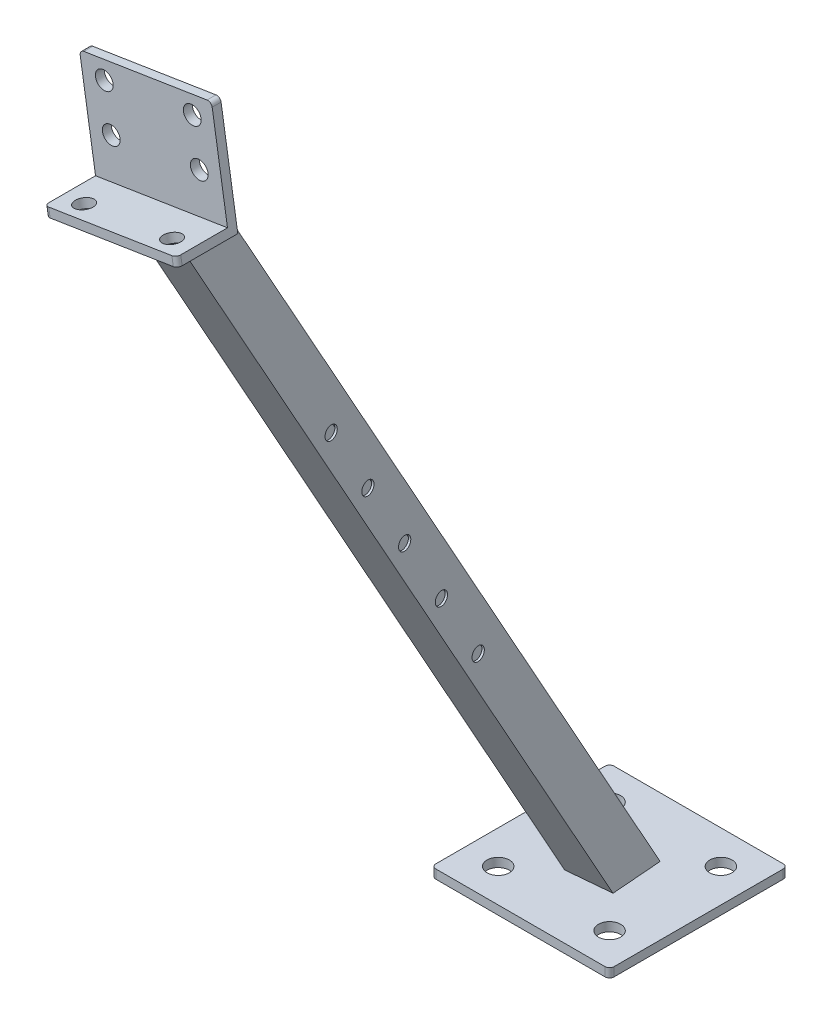
from build123d import *

# Parameters (mm, degrees)
BOSS_EXTRUDE1_DEPTH      = 60
BOSS_EXTRUDE2_DEPTH      = 500
BOSS_EXTRUDE2_DEPTH_BACK = 20
SKETCH3_W                = 20
SKETCH3_H                = 20
SKETCH3_W_2              = 18
SKETCH3_H_2              = 18
CUT_EXTRUDE1_DEPTH       = 60
SKETCH7_W                = 80
SKETCH7_H                = 80
BOSS_EXTRUDE3_DEPTH      = 4
SKETCH8_W                = 96.387466959
SKETCH8_H                = 104.058165024
CUT_EXTRUDE3_DEPTH       = 100
CUT_EXTRUDE4_REACH       = 450.752
SKETCH9_R                = 3.999999996
CUT_EXTRUDE5_REACH       = 450.752
SKETCH10_R               = 4.000000003
CUT_EXTRUDE6_REACH       = 492.61
SKETCH11_R               = 5
FILLET1_R                = 2
FILLET2_R                = 2
SKETCH12_RX              = 3
SKETCH12_RY              = 2.990164225
CUT_EXTRUDE7_DEPTH       = 450.440488821
BODY_MOVE_COPY1_ANGLE    = 9.0000001


with BuildPart() as part:
    # Sketch1 → Boss-Extrude1 (new body)
    with BuildSketch(Plane(origin=(0, 0, 0), x_dir=(0, 0, -1), z_dir=(1, 0, 0))):
        Polygon((0, 0), (0, 50), (-4, 50), (-4, 4), (-27, 4), (-27, 0), align=None)
    extrude(amount=BOSS_EXTRUDE1_DEPTH)

    # Sketch3 → Boss-Extrude2 (add, two sides: drawn at the far end of the back side and taken through both)
    with BuildSketch(Plane(origin=(0.734152256, 4.01424851, 2.317627458), x_dir=(0, -0.49999999999998884, 0.866025403784445), z_dir=(-0.1564344650402179, -0.8553631939770945, -0.4938441702975589)).offset(-BOSS_EXTRUDE2_DEPTH_BACK)):
        with Locations((0, -29.630650218)):
            Rectangle(SKETCH3_W, SKETCH3_H)
        with Locations((0, -29.630650218)):
            Rectangle(SKETCH3_W_2, SKETCH3_H_2, mode=Mode.SUBTRACT)
    extrude(amount=BOSS_EXTRUDE2_DEPTH + BOSS_EXTRUDE2_DEPTH_BACK)

    # Sketch5 → Cut-Extrude1 (cut)
    with BuildSketch(Plane.ZY):
        Polygon((4, 4), (4, 36.054903459), (38.781358344, 4), align=None)
    extrude(amount=-CUT_EXTRUDE1_DEPTH, mode=Mode.SUBTRACT)

    # Sketch7 → Boss-Extrude3 (add)
    with BuildSketch(Plane(origin=(-56.75697757, -358.349448921, -6.04e-07), x_dir=(0.9876883403131397, -0.15643446682069614, -2.6345369953248584e-10), z_dir=(0.15643446682069614, 0.9876883403131398, 1.6633811750632153e-09))):
        with Locations((20.602499468, 205.593738915)):
            Rectangle(SKETCH7_W, SKETCH7_H)
    extrude(amount=BOSS_EXTRUDE3_DEPTH)

    # Sketch8 → Cut-Extrude3 (cut)
    with BuildSketch(Plane(origin=(-56.75697757, -358.349448921, -6.04e-07), x_dir=(0.9876883403131398, -0.15643446682069642, -2.6345368640035017e-10), z_dir=(-0.15643446682069642, -0.9876883403131398, -1.6633810921501747e-09))):
        with Locations((22.720042887, -232.311236701)):
            Rectangle(SKETCH8_W, SKETCH8_H)
    extrude(amount=CUT_EXTRUDE3_DEPTH, mode=Mode.SUBTRACT)

    # Sketch9 → Cut-Extrude4 (cut, up to next)
    with BuildSketch(Plane(origin=(0, 0, 0), x_dir=(-1, 0, 0), z_dir=(0, 0, -1)), mode=Mode.PRIVATE) as cut_extrude4_sk1:
        with Locations((-50, 22)):
            Circle(SKETCH9_R)
    cut_extrude4_tool1 = extrude(cut_extrude4_sk1.sketch, amount=-CUT_EXTRUDE4_REACH, mode=Mode.PRIVATE) & part.part
    # Sketch9 → Cut-Extrude4 (cut, up to next)
    with BuildSketch(Plane(origin=(0, 0, 0), x_dir=(-1, 0, 0), z_dir=(0, 0, -1)), mode=Mode.PRIVATE) as cut_extrude4_sk2:
        with Locations((-10, 22)):
            Circle(SKETCH9_R)
    cut_extrude4_tool2 = extrude(cut_extrude4_sk2.sketch, amount=-CUT_EXTRUDE4_REACH, mode=Mode.PRIVATE) & part.part
    # Sketch9 → Cut-Extrude4 (cut, up to next)
    with BuildSketch(Plane(origin=(0, 0, 0), x_dir=(-1, 0, 0), z_dir=(0, 0, -1)), mode=Mode.PRIVATE) as cut_extrude4_sk3:
        with Locations((-10, 42)):
            Circle(SKETCH9_R)
    cut_extrude4_tool3 = extrude(cut_extrude4_sk3.sketch, amount=-CUT_EXTRUDE4_REACH, mode=Mode.PRIVATE) & part.part
    # Sketch9 → Cut-Extrude4 (cut, up to next)
    with BuildSketch(Plane(origin=(0, 0, 0), x_dir=(-1, 0, 0), z_dir=(0, 0, -1)), mode=Mode.PRIVATE) as cut_extrude4_sk4:
        with Locations((-50, 42)):
            Circle(SKETCH9_R)
    cut_extrude4_tool4 = extrude(cut_extrude4_sk4.sketch, amount=-CUT_EXTRUDE4_REACH, mode=Mode.PRIVATE) & part.part
    add(cut_extrude4_tool1.solids().sort_by_distance((50, 22, 0))[0], mode=Mode.SUBTRACT)
    add(cut_extrude4_tool2.solids().sort_by_distance((10, 22, 0))[0], mode=Mode.SUBTRACT)
    add(cut_extrude4_tool3.solids().sort_by_distance((10, 42, 0))[0], mode=Mode.SUBTRACT)
    add(cut_extrude4_tool4.solids().sort_by_distance((50, 42, 0))[0], mode=Mode.SUBTRACT)

    # Sketch10 → Cut-Extrude5 (cut, up to next)
    with BuildSketch(Plane.XZ, mode=Mode.PRIVATE) as cut_extrude5_sk1:
        with Locations(Location((50, 19, 0), (0, 0, 270))):
            Circle(SKETCH10_R)
    cut_extrude5_tool1 = extrude(cut_extrude5_sk1.sketch, amount=-CUT_EXTRUDE5_REACH, mode=Mode.PRIVATE) & part.part
    # Sketch10 → Cut-Extrude5 (cut, up to next)
    with BuildSketch(Plane.XZ, mode=Mode.PRIVATE) as cut_extrude5_sk2:
        with Locations(Location((10, 19, 0), (0, 0, 270))):
            Circle(SKETCH10_R)
    cut_extrude5_tool2 = extrude(cut_extrude5_sk2.sketch, amount=-CUT_EXTRUDE5_REACH, mode=Mode.PRIVATE) & part.part
    add(cut_extrude5_tool1.solids().sort_by_distance((50, 0, 19))[0], mode=Mode.SUBTRACT)
    add(cut_extrude5_tool2.solids().sort_by_distance((10, 0, 19))[0], mode=Mode.SUBTRACT)

    # Sketch11 → Cut-Extrude6 (cut, up to next)
    with BuildSketch(Plane(origin=(-56.75697757, -358.349448921, -6.04e-07), x_dir=(0.9876883403131398, -0.15643446682069645, -2.634536864003504e-10), z_dir=(-0.15643446682069645, -0.9876883403131398, -1.6633810921501756e-09)), mode=Mode.PRIVATE) as cut_extrude6_sk1:
        with Locations((-4.397500532, -180.593738915)):
            Circle(SKETCH11_R)
    cut_extrude6_tool1 = extrude(cut_extrude6_sk1.sketch, amount=-CUT_EXTRUDE6_REACH, mode=Mode.PRIVATE) & part.part
    # Sketch11 → Cut-Extrude6 (cut, up to next)
    with BuildSketch(Plane(origin=(-56.75697757, -358.349448921, -6.04e-07), x_dir=(0.9876883403131398, -0.15643446682069645, -2.634536864003504e-10), z_dir=(-0.15643446682069645, -0.9876883403131398, -1.6633810921501756e-09)), mode=Mode.PRIVATE) as cut_extrude6_sk2:
        with Locations((45.602499468, -180.593738915)):
            Circle(SKETCH11_R)
    cut_extrude6_tool2 = extrude(cut_extrude6_sk2.sketch, amount=-CUT_EXTRUDE6_REACH, mode=Mode.PRIVATE) & part.part
    # Sketch11 → Cut-Extrude6 (cut, up to next)
    with BuildSketch(Plane(origin=(-56.75697757, -358.349448921, -6.04e-07), x_dir=(0.9876883403131398, -0.15643446682069645, -2.634536864003504e-10), z_dir=(-0.15643446682069645, -0.9876883403131398, -1.6633810921501756e-09)), mode=Mode.PRIVATE) as cut_extrude6_sk3:
        with Locations((45.602499468, -230.593738915)):
            Circle(SKETCH11_R)
    cut_extrude6_tool3 = extrude(cut_extrude6_sk3.sketch, amount=-CUT_EXTRUDE6_REACH, mode=Mode.PRIVATE) & part.part
    # Sketch11 → Cut-Extrude6 (cut, up to next)
    with BuildSketch(Plane(origin=(-56.75697757, -358.349448921, -6.04e-07), x_dir=(0.9876883403131398, -0.15643446682069645, -2.634536864003504e-10), z_dir=(-0.15643446682069645, -0.9876883403131398, -1.6633810921501756e-09)), mode=Mode.PRIVATE) as cut_extrude6_sk4:
        with Locations((-4.397500532, -230.593738915)):
            Circle(SKETCH11_R)
    cut_extrude6_tool4 = extrude(cut_extrude6_sk4.sketch, amount=-CUT_EXTRUDE6_REACH, mode=Mode.PRIVATE) & part.part
    add(cut_extrude6_tool1.solids().sort_by_distance((-61.100338, -357.661528, -180.59374))[0], mode=Mode.SUBTRACT)
    add(cut_extrude6_tool2.solids().sort_by_distance((-11.715921, -365.483251, -180.59374))[0], mode=Mode.SUBTRACT)
    add(cut_extrude6_tool3.solids().sort_by_distance((-11.715921, -365.483251, -230.59374))[0], mode=Mode.SUBTRACT)
    add(cut_extrude6_tool4.solids().sort_by_distance((-61.100338, -357.661528, -230.59374))[0], mode=Mode.SUBTRACT)

    # Fillet1
    fillet1_edges = [part.edges().sort_by_distance(p)[0] for p in [
        (60, 50, 2),
        (60, 2, 27),
        (0, 2, 27),
        (0, 50, 2),
    ]]
    fillet(fillet1_edges, radius=FILLET1_R)

    # Fillet2
    # the kernel refuses this fillet: 2 mm, written as the material it takes off along each edge
    with BuildSketch(Plane(origin=(-76.697835011, -360.253452555, -245.593739522), x_dir=(2.0026115353614065e-15, -1.6841157483071222e-09, 1.0), z_dir=(0.15643446682069614, 0.9876883403131398, 1.6633811750632153e-09)), Plane(origin=(-76.697835011, -360.25345269, -165.593739522), x_dir=(0.9876883403131398, -0.15643446682069614, -2.6345503556510203e-10), z_dir=(0.15643446682069614, 0.9876883403131398, 1.6633811750632153e-09))) as fillet2_piece_1:
        with BuildLine():
            CenterArc((FILLET2_R, FILLET2_R), FILLET2_R, 180, 90)
            Line((0, FILLET2_R), (0, 0))
            Line((0, 0), (FILLET2_R, 0))
        make_face()
    extrude(amount=14, mode=Mode.SUBTRACT)
    with BuildSketch(Plane(origin=(2.317232214, -372.768210036, -165.593739543), x_dir=(-0.9876883403131397, 0.15643446682069614, 2.634550355651978e-10), z_dir=(0.15643446682069614, 0.9876883403131398, 1.6633811750632153e-09)), Plane(origin=(2.317232214, -372.768209901, -245.593739543), x_dir=(3.794677757079849e-15, -1.6841160321425312e-09, 1.0), z_dir=(0.15643446682069614, 0.9876883403131398, 1.6633811750632153e-09))) as fillet2_piece_2:
        with BuildLine():
            CenterArc((FILLET2_R, -FILLET2_R), FILLET2_R, 90, 90)
            Line((0, -FILLET2_R), (0, 0))
            Line((0, 0), (FILLET2_R, 0))
        make_face()
    extrude(amount=14, mode=Mode.SUBTRACT)

    # Sketch12 → Cut-Extrude7 (cut, through all)
    with BuildSketch(Plane(origin=(19.388964338, -2.659486302, -1.535455133), x_dir=(0.07749165674017042, -0.01062913913579635, 0.9969363392598826), z_dir=(-0.9876883405951398, 0.13547622075225838, 0.0782172325201072))):
        with Locations(Location((-61.225870001, -111.995471629), (0, 0, 75.129892126))):
            Ellipse(SKETCH12_RX, SKETCH12_RY)
        with Locations(Location((-78.507188468, -142.423004822), (0, 0, 75.129892126))):
            Ellipse(SKETCH12_RX, SKETCH12_RY)
        with Locations(Location((-95.788506935, -172.850538016), (0, 0, 75.129892126))):
            Ellipse(SKETCH12_RX, SKETCH12_RY)
        with Locations(Location((-113.069825401, -203.278071209), (0, 0, 75.129892126))):
            Ellipse(SKETCH12_RX, SKETCH12_RY)
        with Locations(Location((-130.351143868, -233.705604403), (0, 0, 75.129892126))):
            Ellipse(SKETCH12_RX, SKETCH12_RY)
    extrude(amount=-CUT_EXTRUDE7_DEPTH, mode=Mode.SUBTRACT)


with BuildPart() as part_1:
    # Body-Move/Copy1: read off the stored shape, not the designer's step
    # Body-Move/Copy1: moved
    add(part.part.moved(Location((0.6987726, 367.2281964, 0))).rotate(Axis((0, 0, 0), (-1.06e-08, 0, 1.0)), BODY_MOVE_COPY1_ANGLE))


solid = part_1.part
